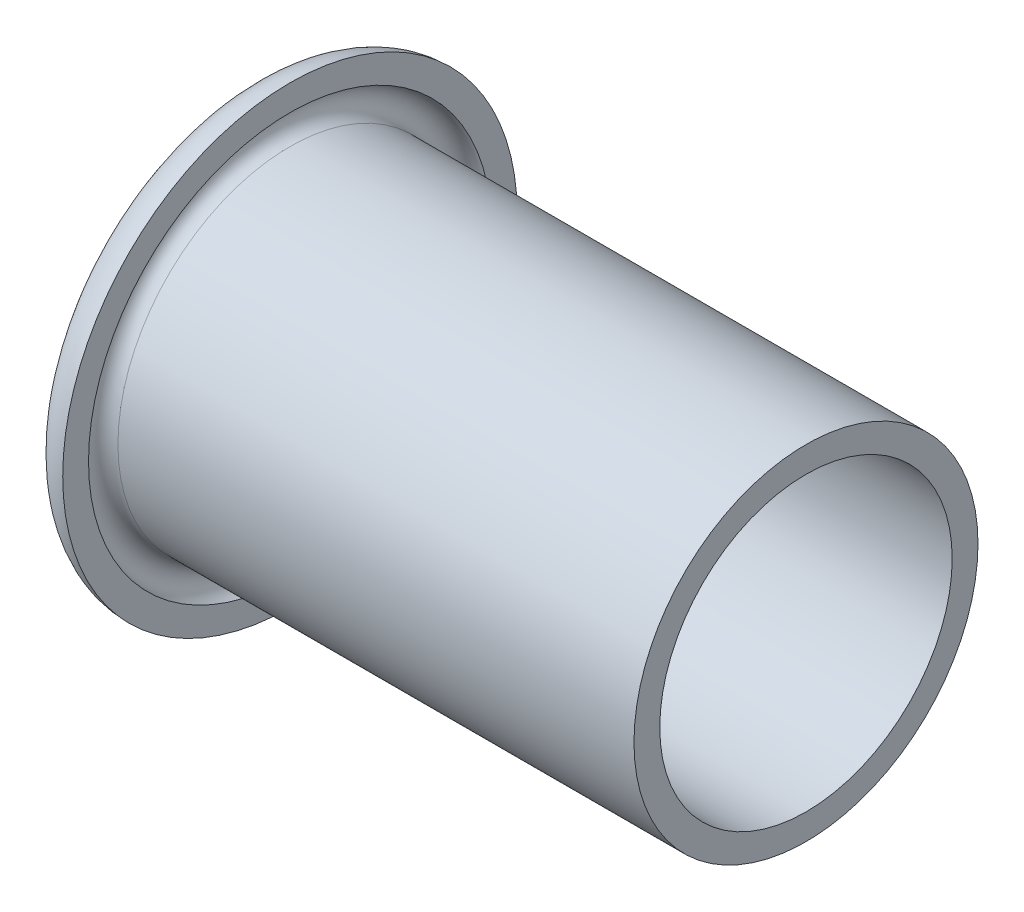
from build123d import *


with BuildPart() as part:
    # Sketch1 → Base-Revolve (revolve)
    with BuildSketch(Plane.XY):
        with BuildLine():
            Line((32.355, 8.5), (32.355, 10))
            Line((32.355, 10), (2.355, 10))
            ThreePointArc((2.355, 10), (1.5, 10.855), (2.355, 11.71))
            Line((2.355, 11.71), (2.355, 13.21))
            ThreePointArc((2.355, 13.21), (0, 10.855), (2.355, 8.5))
            Line((2.355, 8.5), (32.355, 8.5))
        make_face()
    revolve(axis=Axis((-26.751259671, 0, 0), (1, 0, 0)))


solid = part.part
